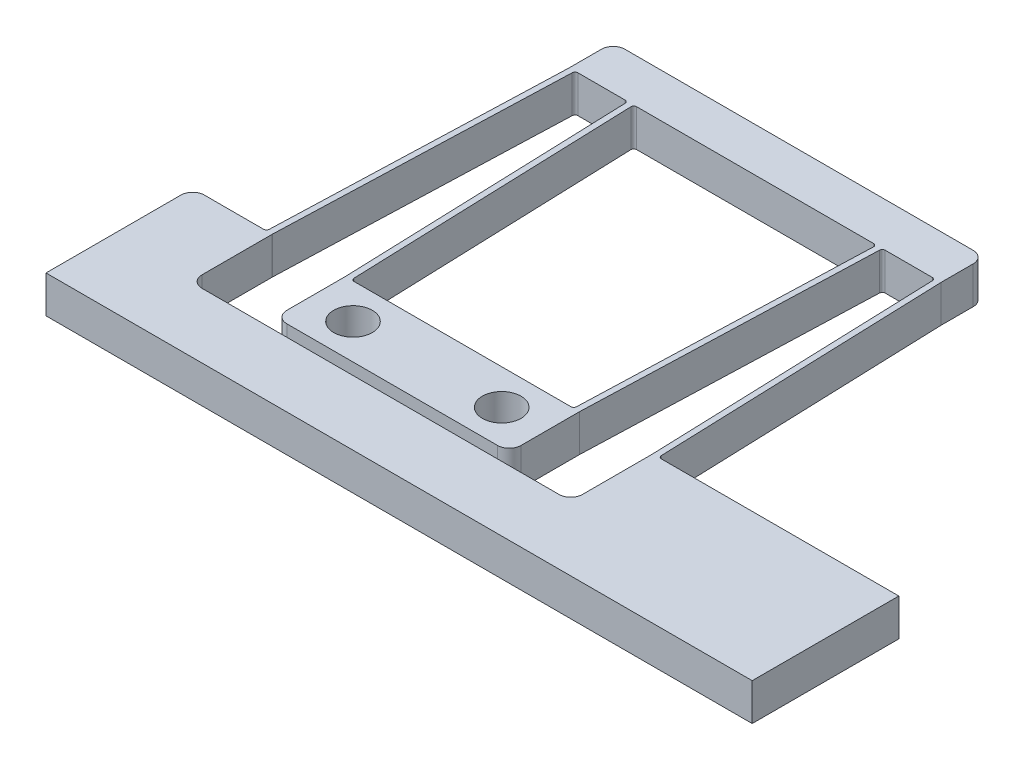
from build123d import *

# Parameters (mm, degrees)
CORNER_EXTRUDE_DEPTH    = 3.175
FLEXTURE_BEAM_FILLETS_R = 0.5
OUTER_FILLETS_R         = 2
M6_CLEARANCE_HOLE1_D    = 6.6


with BuildPart() as part:
    # ADJUST THIS Flexture-Corner → Corner-Extrude (new, symmetric)
    with BuildSketch(Plane(origin=(0, 0, 0), x_dir=(1, 0, 0), z_dir=(0, 1, 0))):
        Polygon((-42.79442893, 75.05), (-42.79442893, 82.55), (-106.30357107, 82.55), (-106.30357107, 75.05), (-108.049609544, 25.05), (-120.65, 25.05), (-120.65, 0), (0, 0), (0, 25.05), (-41.048390456, 25.05), align=None)
        Polygon((-52.802961525, 75.05), (-43.795038475, 75.05), (-42.049, 25.05), (-42.049, 11.05), (-107.049, 11.05), (-107.049, 25.05), (-105.302961525, 75.05), (-96.295038475, 75.05), (-94.549, 25.05), (-94.549, 13.05), (-54.549, 13.05), (-54.549, 25.05), align=None, mode=Mode.SUBTRACT)
        Polygon((-95.29442893, 75.05), (-53.80357107, 75.05), (-55.549609544, 25.05), (-93.548390456, 25.05), align=None, mode=Mode.SUBTRACT)
    extrude(amount=CORNER_EXTRUDE_DEPTH, both=True)

    # Flexture-Beam-Fillets
    flexture_beam_fillets_edges = [part.edges().sort_by_distance(p)[0] for p in [
        (-55.549609544, 0, -25.05),
        (-108.049609544, 0, -25.05),
        (-93.548390456, 0, -25.05),
        (-54.549, 0, -25.05),
        (-41.048390456, 0, -25.05),
        (-43.795038475, 0, -75.05),
        (-53.80357107, 0, -75.05),
        (-106.30357107, 0, -75.05),
        (-42.79442893, 0, -75.05),
        (-52.802961525, 0, -75.05),
        (-95.29442893, 0, -75.05),
        (-96.295038475, 0, -75.05),
        (-105.302961525, 0, -75.05),
        (-94.549, 0, -25.05),
        (-42.049, 0, -25.05),
        (-107.049, 0, -25.05),
    ]]
    fillet(flexture_beam_fillets_edges, radius=FLEXTURE_BEAM_FILLETS_R)

    # Outer-Fillets
    outer_fillets_edges = [part.edges().sort_by_distance(p)[0] for p in [
        (-54.549, 0, -13.05),
        (-42.79442893, 0, -82.55),
        (-42.049, 0, -11.05),
        (-94.549, 0, -13.05),
        (-107.049, 0, -11.05),
        (-106.30357107, 0, -82.55),
        (-120.65, 0, -25.05),
    ]]
    fillet(outer_fillets_edges, radius=OUTER_FILLETS_R)

    # M6 Clearance Hole1 (through all)
    with Locations(Plane(origin=(0, 3.175, 0), x_dir=(1, 0, 0), z_dir=(0, 1, 0))):
        with Locations((-87.249, -19.05), (-61.849, -19.05), (-61.849, 19.05), (-87.249, 19.05), (61.849, 19.05), (87.249, 19.05), (61.849, -19.05), (87.249, -19.05)):
            Hole(M6_CLEARANCE_HOLE1_D / 2)


solid = part.part
